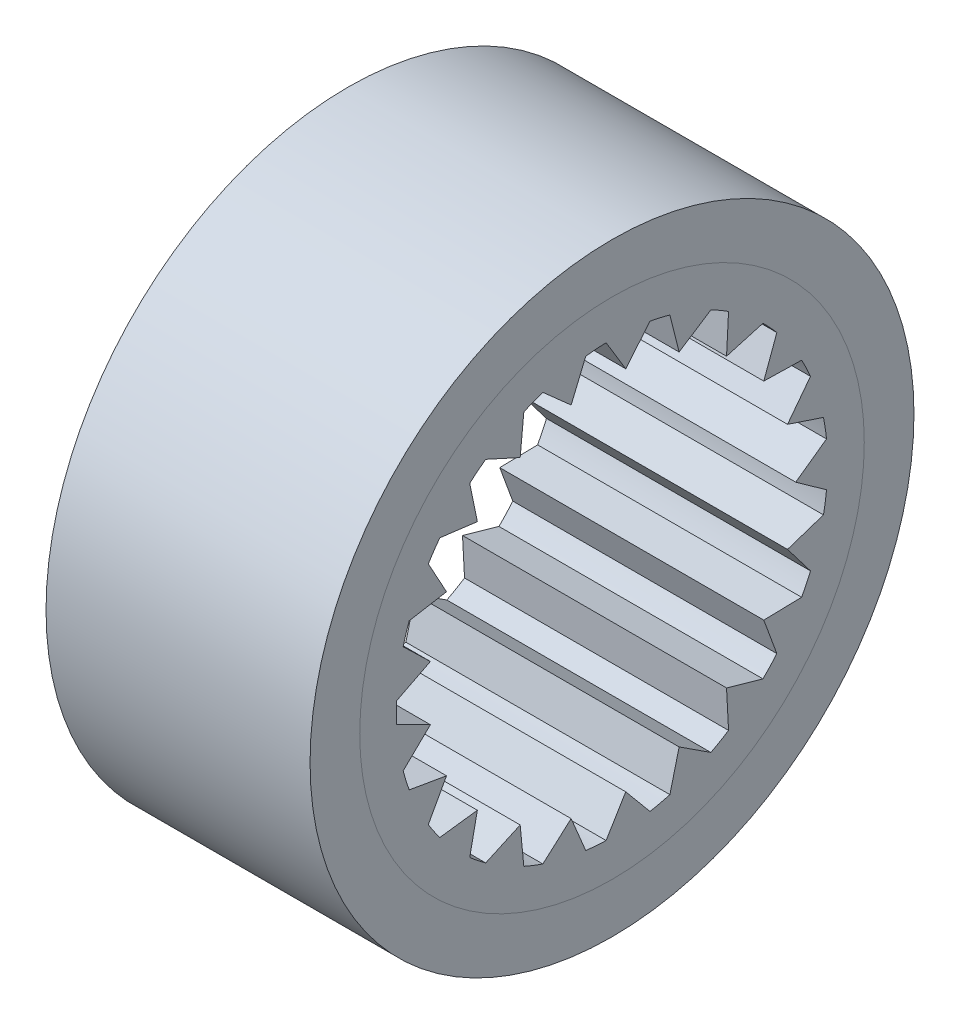
from build123d import *

# Parameters (mm, degrees)
EXTRUDE_1_OUTLINE_R      = 2.45
EXTRUDE_1_DEPTH          = 3
EXTRUDE_2_DEPTH          = 3
PATTERN_CIRCULAR_1_COUNT = 21
SKETCH2_R                = 8.547586549
SKETCH2_R_2              = 3.001513839
CUT_EXTRUDE1_DEPTH       = 10
BOSS_EXTRUDE1_DEPTH      = 3
CIRPATTERN6_COUNT        = 22
CIRPATTERN6_ANGLE        = 345.24
SKETCH_2_R               = 4.158407847
SKETCH_2_R_2             = 2.866491316
CUT_EXTRUDE_1_DEPTH      = 10
SKETCH_3_R               = 3.430993381
SKETCH_3_R_2             = 2.866491316
EXTRUDE_3_DEPTH          = 3


# Read off the part's stored shape, not the designer's step: Бобышка-Вытянуть1, Бобышка-Вытянуть2
with BuildPart() as part:
    # Бобышка-Вытянуть1 outline → Бобышка-Вытянуть1 (new body)
    with BuildSketch(Plane.YZ):
        with BuildLine():
            ThreePointArc((7.60775827, -34.09831761), (6.73424843, -33.630363316), (5.760344946, -33.44729867))
            add(Edge.make_bspline(
                [(5.760344946, -33.44729867), (5.46713328, -33.652163863), (5.029274696, -33.876555627), (4.421054767, -33.805447152), (4.212742264, -33.546022471), (4.096748531, -33.239168782), (3.977348555, -32.974896207), (3.887120883, -32.809203227), (3.860215155, -32.76273366)],
                knots=[0, 0, 0, 0, 0.384536387, 0.512259949, 0.613992842, 0.721907854, 0.866992584, 0.924751204, 0.924751204, 0.924751204, 0.924751204], degree=3))
            add(Edge.make_bspline(
                [(4.213382498, -30.770846655), (3.889503683, -30.922653577), (3.476501747, -31.190050668), (3.234513044, -31.752571214), (3.355322595, -32.062571724), (3.563312271, -32.31625268), (3.733540633, -32.552791241), (3.832728628, -32.714954029), (3.860215155, -32.76273366)],
                knots=[0, 0, 0, 0, 0.384536387, 0.512259949, 0.613992842, 0.721907854, 0.866992584, 0.926284353, 0.926284353, 0.926284353, 0.926284353], degree=3))
            ThreePointArc((4.213382498, -30.770846655), (4.540898548, -29.835574557), (4.571443, -28.845085941))
            ThreePointArc((4.571443, -28.845085941), (3.833465447, -28.344311993), (3.030421179, -27.956361842))
            ThreePointArc((3.030421179, -27.956361842), (2.188405953, -28.478866407), (1.542915576, -29.230759241))
            add(Edge.make_bspline(
                [(1.542915576, -29.230759241), (1.573728205, -29.587120589), (1.549127882, -30.078513128), (1.183436171, -30.5696928), (0.854611556, -30.620384379), (0.530871599, -30.567411055), (0.242304847, -30.538678179), (0.053696682, -30.533971145), (-8e-09, -30.534037406)],
                knots=[0, 0, 0, 0, 0.384536387, 0.512259949, 0.613992842, 0.721907854, 0.866992584, 0.924751204, 0.924751204, 0.924751204, 0.924751204], degree=3))
            add(Edge.make_bspline(
                [(-1.548441084, -29.232242013), (-1.578911841, -29.588632755), (-1.553840136, -30.080001469), (-1.187677404, -30.570830107), (-0.858804311, -30.621206221), (-0.535115321, -30.567922356), (-0.245152737, -30.53876955), (-0.055121646, -30.533951621), (-8e-09, -30.534037406)],
                knots=[0, 0, 0, 0, 0.384536387, 0.512259949, 0.613992842, 0.721907854, 0.866992584, 0.926284353, 0.926284353, 0.926284353, 0.926284353], degree=3))
            ThreePointArc((-1.548441084, -29.232242013), (-2.194652456, -28.480968744), (-3.037168533, -27.959272165))
            ThreePointArc((-3.037168533, -27.959272165), (-3.839840271, -28.347992499), (-4.577337091, -28.84947416))
            ThreePointArc((-4.577337091, -28.84947416), (-4.545842477, -29.839933019), (-4.217429369, -30.7748905))
            add(Edge.make_bspline(
                [(-4.217429369, -30.7748905), (-3.893405075, -30.926386654), (-3.480146815, -31.193387429), (-3.237618596, -31.755675577), (-3.358130708, -32.065791836), (-3.565876932, -32.3196722), (-3.735043708, -32.5552119), (-3.833424202, -32.716197846), (-3.860215162, -32.762733674)],
                knots=[0, 0, 0, 0, 0.384536387, 0.512259949, 0.613992842, 0.721907854, 0.866992584, 0.924751204, 0.924751204, 0.924751204, 0.924751204], degree=3))
            add(Edge.make_bspline(
                [(-5.761823582, -33.452825286), (-5.468415524, -33.657409106), (-5.030341882, -33.881380729), (-4.422190447, -33.80968882), (-4.214126907, -33.550064425), (-4.098427592, -33.243099604), (-3.978693371, -32.977408237), (-3.887850274, -32.81042752), (-3.860215162, -32.762733674)],
                knots=[0, 0, 0, 0, 0.384536387, 0.512259949, 0.613992842, 0.721907854, 0.866992584, 0.926284353, 0.926284353, 0.926284353, 0.926284353], degree=3))
            ThreePointArc((-5.761823582, -33.452825286), (-6.735551004, -33.636824115), (-7.608611533, -34.105616152))
            ThreePointArc((-7.608611533, -34.105616152), (-7.673305717, -34.995110434), (-7.60775827, -35.884542246))
            ThreePointArc((-7.60775827, -35.884542246), (-6.73424843, -36.35249654), (-5.760344946, -36.535561187))
            add(Edge.make_bspline(
                [(-5.760344946, -36.535561187), (-5.46713328, -36.330695993), (-5.029274696, -36.106304229), (-4.421054767, -36.177412704), (-4.212742264, -36.436837385), (-4.096748531, -36.743691074), (-3.977348555, -37.007963649), (-3.887120883, -37.173656629), (-3.860215155, -37.220126196)],
                knots=[0, 0, 0, 0, 0.384536387, 0.512259949, 0.613992842, 0.721907854, 0.866992584, 0.924751204, 0.924751204, 0.924751204, 0.924751204], degree=3))
            add(Edge.make_bspline(
                [(-4.213382498, -39.212013201), (-3.889503683, -39.060206279), (-3.476501747, -38.792809189), (-3.234513044, -38.230288642), (-3.355322595, -37.920288132), (-3.563312271, -37.666607177), (-3.733540633, -37.430068615), (-3.832728628, -37.267905828), (-3.860215155, -37.220126196)],
                knots=[0, 0, 0, 0, 0.384536387, 0.512259949, 0.613992842, 0.721907854, 0.866992584, 0.926284353, 0.926284353, 0.926284353, 0.926284353], degree=3))
            ThreePointArc((-4.213382498, -39.212013201), (-4.540898548, -40.147285299), (-4.571443, -41.137773915))
            ThreePointArc((-4.571443, -41.137773915), (-3.833465447, -41.638547863), (-3.030421179, -42.026498015))
            ThreePointArc((-3.030421179, -42.026498015), (-2.188405953, -41.503993449), (-1.542915576, -40.752100615))
            add(Edge.make_bspline(
                [(-1.542915576, -40.752100615), (-1.573728205, -40.395739267), (-1.549127882, -39.904346728), (-1.183436171, -39.413167056), (-0.854611556, -39.362475477), (-0.530871599, -39.415448802), (-0.242304847, -39.444181677), (-0.053696682, -39.448888711), (8e-09, -39.44882245)],
                knots=[0, 0, 0, 0, 0.384536387, 0.512259949, 0.613992842, 0.721907854, 0.866992584, 0.924751204, 0.924751204, 0.924751204, 0.924751204], degree=3))
            add(Edge.make_bspline(
                [(1.548441084, -40.750617843), (1.578911841, -40.394227101), (1.553840136, -39.902858387), (1.187677404, -39.41202975), (0.858804311, -39.361653636), (0.535115321, -39.4149375), (0.245152737, -39.444090306), (0.055121646, -39.448908236), (8e-09, -39.44882245)],
                knots=[0, 0, 0, 0, 0.384536387, 0.512259949, 0.613992842, 0.721907854, 0.866992584, 0.926284353, 0.926284353, 0.926284353, 0.926284353], degree=3))
            ThreePointArc((1.548441084, -40.750617843), (2.194652456, -41.501891112), (3.037168533, -42.023587691))
            ThreePointArc((3.037168533, -42.023587691), (3.839840271, -41.634867357), (4.577337091, -41.133385696))
            ThreePointArc((4.577337091, -41.133385696), (4.545842477, -40.142926837), (4.217429369, -39.207969356))
            add(Edge.make_bspline(
                [(4.217429369, -39.207969356), (3.893405075, -39.056473202), (3.480146815, -38.789472427), (3.237618596, -38.22718428), (3.358130708, -37.91706802), (3.565876932, -37.663187656), (3.735878304, -37.426485903), (3.834910691, -37.264228039), (3.862345998, -37.216418958)],
                knots=[0, 0, 0, 0, 0.384536387, 0.512259949, 0.613992842, 0.721907854, 0.866992584, 0.926284353, 0.926284353, 0.926284353, 0.926284353], degree=3))
            add(Edge.make_bspline(
                [(5.761823582, -36.53003457), (5.468415524, -36.32545075), (5.030341882, -36.101479127), (4.422190447, -36.173171036), (4.214126907, -36.432795431), (4.098427592, -36.739760252), (3.979281188, -37.004147246), (3.889212507, -37.169926706), (3.862345998, -37.216418958)],
                knots=[0, 0, 0, 0, 0.384536387, 0.512259949, 0.613992842, 0.721907854, 0.866992584, 0.924751204, 0.924751204, 0.924751204, 0.924751204], degree=3))
            ThreePointArc((5.761823582, -36.53003457), (6.735551004, -36.346035741), (7.608611533, -35.877243704))
            ThreePointArc((7.608611533, -35.877243704), (7.673305717, -34.987749422), (7.60775827, -34.09831761))
        make_face()
        with Locations((0, -34.991429928)):
            Circle(EXTRUDE_1_OUTLINE_R, mode=Mode.SUBTRACT)
    extrude(amount=EXTRUDE_1_DEPTH)

    # Бобышка-Вытянуть2 outline → Бобышка-Вытянуть2 (add)
    with BuildSketch(Plane.YZ):
        with BuildLine():
            Line((0.25, -37.428641449), (0, -37.078641449))
            Line((0, -37.078641449), (-0.25, -37.428641449))
            ThreePointArc((-0.25, -37.428641449), (0, -37.441429928), (0.25, -37.428641449))
        make_face()
    extrude_2 = extrude(amount=EXTRUDE_2_DEPTH)

    # Круговой массив1: Бобышка-Вытянуть2 ×21 about axis
    pattern_circular_1_axis = Axis((0, 0, -34.991429928), (1, 0, 0))
    for i in range(1, PATTERN_CIRCULAR_1_COUNT):
        add(extrude_2.rotate(pattern_circular_1_axis, i * 360 / PATTERN_CIRCULAR_1_COUNT))

    # Sketch2 → Cut-Extrude1 (cut)
    with BuildSketch(Plane(origin=(3, 0, 0), x_dir=(0, 0, -1), z_dir=(1, 0, 0))):
        with Locations((34.991429928, 0)):
            Circle(SKETCH2_R)
        with Locations((34.991429928, 0)):
            Circle(SKETCH2_R_2, mode=Mode.SUBTRACT)
    extrude(amount=-CUT_EXTRUDE1_DEPTH, mode=Mode.SUBTRACT)

    # Sketch3 → Boss-Extrude1 (add)
    with BuildSketch(Plane(origin=(3, 0, 0), x_dir=(0, 0, -1), z_dir=(1, 0, 0))):
        Polygon((32.116918179, 0.398551141), (31.120540325, 0), (32.116918179, -0.398551141), (32.116918179, -0.001448859), (32.116918179, 0.001448859), align=None)
    boss_extrude1 = extrude(amount=-BOSS_EXTRUDE1_DEPTH)

    # CirPattern6: Boss-Extrude1 ×22 about axis
    cirpattern6_axis = Axis((0, 0, -34.991429928), (1, 0, 0))
    for i in range(1, CIRPATTERN6_COUNT):
        add(boss_extrude1.rotate(cirpattern6_axis, i * CIRPATTERN6_ANGLE / (CIRPATTERN6_COUNT - 1)))

    # Эскиз2 → Вырез-Вытянуть1 (cut)
    with BuildSketch(Plane(origin=(3, 0, 0), x_dir=(0, 0, -1), z_dir=(1, 0, 0))):
        with Locations((34.991429928, 0)):
            Circle(SKETCH_2_R)
        with Locations((34.991429928, 0)):
            Circle(SKETCH_2_R_2, mode=Mode.SUBTRACT)
    extrude(amount=-CUT_EXTRUDE_1_DEPTH, mode=Mode.SUBTRACT)


with BuildPart() as body_2:
    # Эскиз3 → Бобышка-Вытянуть3 (new body)
    with BuildSketch(Plane(origin=(3, 0, 0), x_dir=(0, 0, -1), z_dir=(1, 0, 0))):
        with Locations((34.991429928, 0)):
            Circle(SKETCH_3_R)
        with Locations((34.991429928, 0)):
            Circle(SKETCH_3_R_2, mode=Mode.SUBTRACT)
    extrude(amount=-EXTRUDE_3_DEPTH)


solid = Compound([part.part, body_2.part])
